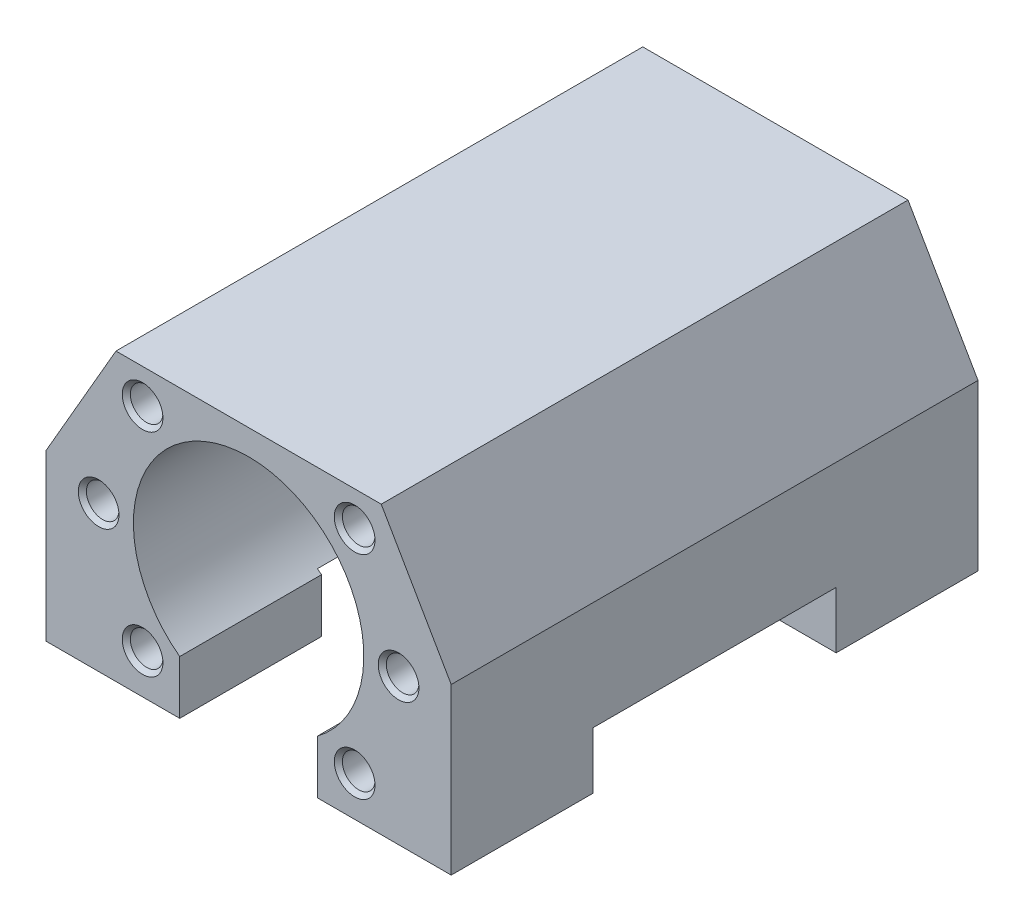
from build123d import *

# Parameters (mm, degrees)
SKETCH1_R                          = 18.05
BOSS_EXTRUDE1_DEPTH                = 41.275
SKETCH6_W                          = 63.5
SKETCH6_H                          = 38.1
CUT_EXTRUDE1_DEPTH                 = 8.89
BOSS_EXTRUDE2_REACH                = 65.289
SKETCH12_W                         = 44
SKETCH12_H                         = 12.7
SKETCH7_W                          = 21.59
SKETCH7_H                          = 82.55
CUT_EXTRUDE2_DEPTH                 = 35
FILLET1_R                          = 10.795
F_1_4_20_TAPPED_HOLE1_AT_2_COUNT   = 2
F_1_4_20_TAPPED_HOLE1_AT_2_PITCH   = 17.986121321
F_1_4_20_TAPPED_HOLE1_AT_3_COUNT   = 2
F_1_4_20_TAPPED_HOLE1_AT_3_PITCH   = 33.234018716
F_1_4_20_TAPPED_HOLE1_AT_4_COUNT   = 2
F_1_4_20_TAPPED_HOLE1_AT_4_PITCH   = 47
F_1_4_20_TAPPED_HOLE1_AT_5_COUNT   = 2
F_1_4_20_TAPPED_HOLE1_AT_5_PITCH   = 43.422338028
F_1_4_20_TAPPED_HOLE1_AT_6_COUNT   = 2
F_1_4_20_TAPPED_HOLE1_AT_6_PITCH   = 33.234018716
F_5_16_18_TAPPED_HOLE1_D           = 6.5278
F_5_16_18_TAPPED_HOLE1_DEPTH       = 20.32
F_5_16_18_TAPPED_HOLE1_CSINK_D     = 9.2075
F_5_16_18_TAPPED_HOLE1_CSINK_ANGLE = 90
F_5_16_18_TAPPED_HOLE1_TIP         = 1.961148974


with BuildPart() as part:
    # Sketch1 → Boss-Extrude1 (new, symmetric)
    with BuildSketch(Plane.XY):
        Polygon((-20.784609691, 22), (20.784609691, 22), (31.75, 3.00738686), (31.75, -22.86), (-31.75, -22.86), (-31.75, 3.00738686), align=None)
        Circle(SKETCH1_R, mode=Mode.SUBTRACT)
    extrude(amount=BOSS_EXTRUDE1_DEPTH, both=True)

    # Sketch6 → Cut-Extrude1 (cut)
    with BuildSketch(Plane.XZ.offset(22.86)):
        Rectangle(SKETCH6_W, SKETCH6_H)
    extrude(amount=-CUT_EXTRUDE1_DEPTH, mode=Mode.SUBTRACT)

    # Sketch12 → Boss-Extrude2 (add, up to next)
    with BuildSketch(Plane.XZ.offset(13.97), mode=Mode.PRIVATE) as boss_extrude2_sk1:
        Rectangle(SKETCH12_W, SKETCH12_H)
    boss_extrude2_tool1 = extrude(boss_extrude2_sk1.sketch, amount=-BOSS_EXTRUDE2_REACH, mode=Mode.PRIVATE) - part.part
    add(boss_extrude2_tool1.solids().sort_by_distance((0, -13.97, 0))[0])

    # Sketch7 → Cut-Extrude2 (cut)
    with BuildSketch(Plane.XZ.offset(22.86)):
        Rectangle(SKETCH7_W, SKETCH7_H)
    extrude(amount=-CUT_EXTRUDE2_DEPTH, mode=Mode.SUBTRACT)

    # Fillet1
    fillet1_edges = [part.edges().sort_by_distance(p)[0] for p in [
        (10.795, 12.14, 0),
        (-10.795, 12.14, 0),
    ]]
    fillet(fillet1_edges, radius=FILLET1_R - 0.0001)  # a hair under: the kernel refuses the full size

    # Sketch3 → 1/4-20 Tapped Hole1 (revolve, cut)
    with BuildSketch(Plane(origin=(-16.617009358, 16.617009358, 41.275), x_dir=(0, -1, 0), z_dir=(1, 0, 0))):
        Polygon((0, 0), (0, 18.043816902), (2.5527, 16.51), (2.5527, 0.635), (3.1877, 0), align=None)
    f_1_4_20_tapped_hole1 = revolve(axis=Axis((-16.617009358, 16.617009358, 47.625), (0, 0, -1)), mode=Mode.SUBTRACT)

    # 1/4-20 Tapped Hole1 at 2: 1/4-20 Tapped Hole1 ×2
    with Locations(*[Vector(-0.38268343236508695, -0.923879532511288, 0) * (i * F_1_4_20_TAPPED_HOLE1_AT_2_PITCH) for i in range(1, F_1_4_20_TAPPED_HOLE1_AT_2_COUNT)]):
        add(f_1_4_20_tapped_hole1, mode=Mode.SUBTRACT)

    # 1/4-20 Tapped Hole1 at 3: 1/4-20 Tapped Hole1 ×2
    with Locations(*[(0, -i * F_1_4_20_TAPPED_HOLE1_AT_3_PITCH, 0) for i in range(1, F_1_4_20_TAPPED_HOLE1_AT_3_COUNT)]):
        add(f_1_4_20_tapped_hole1, mode=Mode.SUBTRACT)

    # 1/4-20 Tapped Hole1 at 4: 1/4-20 Tapped Hole1 ×2
    with Locations(*[Vector(0.7071067811865517, -0.7071067811865434, 0) * (i * F_1_4_20_TAPPED_HOLE1_AT_4_PITCH) for i in range(1, F_1_4_20_TAPPED_HOLE1_AT_4_COUNT)]):
        add(f_1_4_20_tapped_hole1, mode=Mode.SUBTRACT)

    # 1/4-20 Tapped Hole1 at 5: 1/4-20 Tapped Hole1 ×2
    with Locations(*[Vector(0.9238795325112865, -0.38268343236509034, 0) * (i * F_1_4_20_TAPPED_HOLE1_AT_5_PITCH) for i in range(1, F_1_4_20_TAPPED_HOLE1_AT_5_COUNT)]):
        add(f_1_4_20_tapped_hole1, mode=Mode.SUBTRACT)

    # 1/4-20 Tapped Hole1 at 6: 1/4-20 Tapped Hole1 ×2
    with Locations(*[(i * F_1_4_20_TAPPED_HOLE1_AT_6_PITCH, 0, 0) for i in range(1, F_1_4_20_TAPPED_HOLE1_AT_6_COUNT)]):
        add(f_1_4_20_tapped_hole1, mode=Mode.SUBTRACT)

    # Mirror1: 1/4-20 Tapped Hole1 across plane
    add(f_1_4_20_tapped_hole1.mirror(Plane.XY), mode=Mode.SUBTRACT)

    # Mirror1 copy 1 sketch → Mirror1 copy 1 (revolve, cut)
    with BuildSketch(Plane(origin=(-23.5, 0, -41.275), x_dir=(0, -1, 0), z_dir=(1, 0, 0))):
        Polygon((0, 0), (0, -18.043816902), (2.5527, -16.51), (2.5527, -0.635), (3.1877, 0), align=None)
    revolve(axis=Axis((-23.5, 0, -47.625), (0, 0, -1)), mode=Mode.SUBTRACT)

    # Mirror1 copy 2 sketch → Mirror1 copy 2 (revolve, cut)
    with BuildSketch(Plane(origin=(-16.617009358, -16.617009358, -41.275), x_dir=(0, -1, 0), z_dir=(1, 0, 0))):
        Polygon((0, 0), (0, -18.043816902), (2.5527, -16.51), (2.5527, -0.635), (3.1877, 0), align=None)
    revolve(axis=Axis((-16.617009358, -16.617009358, -47.625), (0, 0, -1)), mode=Mode.SUBTRACT)

    # Mirror1 copy 3 sketch → Mirror1 copy 3 (revolve, cut)
    with BuildSketch(Plane(origin=(16.617009358, -16.617009358, -41.275), x_dir=(0, -1, 0), z_dir=(1, 0, 0))):
        Polygon((0, 0), (0, -18.043816902), (2.5527, -16.51), (2.5527, -0.635), (3.1877, 0), align=None)
    revolve(axis=Axis((16.617009358, -16.617009358, -47.625), (0, 0, -1)), mode=Mode.SUBTRACT)

    # Mirror1 copy 4 sketch → Mirror1 copy 4 (revolve, cut)
    with BuildSketch(Plane(origin=(23.5, 0, -41.275), x_dir=(0, -1, 0), z_dir=(1, 0, 0))):
        Polygon((0, 0), (0, -18.043816902), (2.5527, -16.51), (2.5527, -0.635), (3.1877, 0), align=None)
    revolve(axis=Axis((23.5, 0, -47.625), (0, 0, -1)), mode=Mode.SUBTRACT)

    # Mirror1 copy 5 sketch → Mirror1 copy 5 (revolve, cut)
    with BuildSketch(Plane(origin=(16.617009358, 16.617009358, -41.275), x_dir=(0, -1, 0), z_dir=(1, 0, 0))):
        Polygon((0, 0), (0, -18.043816902), (2.5527, -16.51), (2.5527, -0.635), (3.1877, 0), align=None)
    revolve(axis=Axis((16.617009358, 16.617009358, -47.625), (0, 0, -1)), mode=Mode.SUBTRACT)

    # 5/16-18 Tapped Hole1
    with Locations(Plane(origin=(0, -13.97, 0), x_dir=(-1, 0, 0), z_dir=(0, -1, 0))):
        with Locations((-25.4, 0), (25.4, 0)):
            CounterSinkHole(F_5_16_18_TAPPED_HOLE1_D / 2, F_5_16_18_TAPPED_HOLE1_CSINK_D / 2, depth=F_5_16_18_TAPPED_HOLE1_DEPTH, counter_sink_angle=F_5_16_18_TAPPED_HOLE1_CSINK_ANGLE)
            with Locations((0, 0, -(F_5_16_18_TAPPED_HOLE1_DEPTH + F_5_16_18_TAPPED_HOLE1_TIP / 2))):  # 118° drill point
                Cone(0, F_5_16_18_TAPPED_HOLE1_D / 2, F_5_16_18_TAPPED_HOLE1_TIP, mode=Mode.SUBTRACT)


solid = part.part
